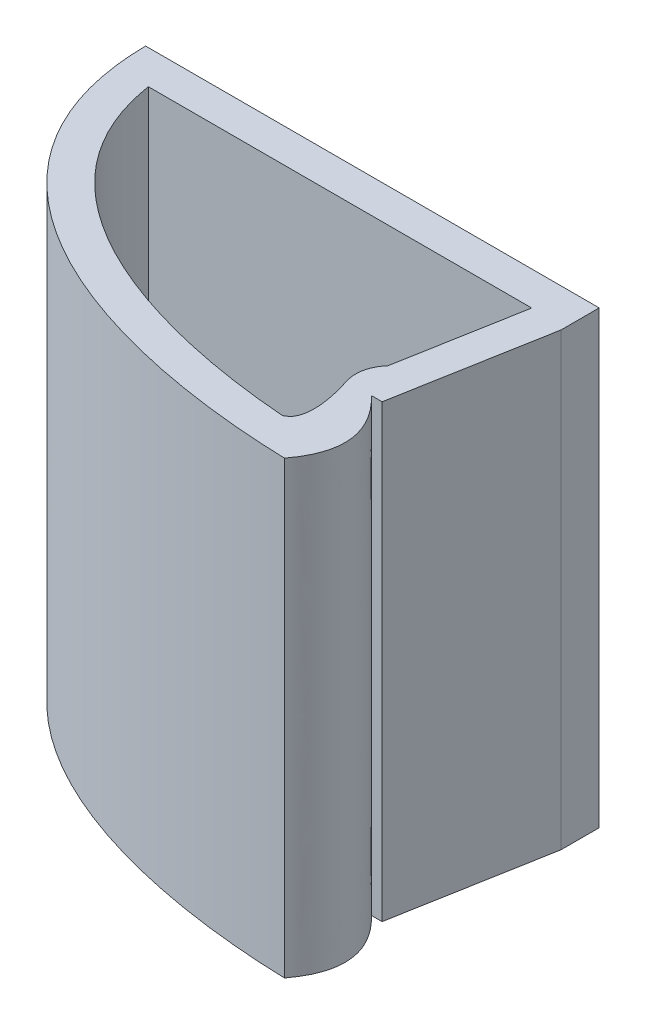
from build123d import *

# Parameters (mm, degrees)
SKETCH1_W           = 13.4
SKETCH1_H           = 13.3
BOSS_EXTRUDE1_DEPTH = 8.5
CUT_EXTRUDE1_DEPTH  = 21.705071842
CUT_EXTRUDE3_DEPTH  = 21.705072012
CUT_EXTRUDE4_DEPTH  = 21.701642146
FILLET1_R           = 1


with BuildPart() as part:
    # Sketch1 → Boss-Extrude1 (new body)
    with BuildSketch(Plane.XY):
        with Locations((6.7, 6.65)):
            Rectangle(SKETCH1_W, SKETCH1_H)
    extrude(amount=BOSS_EXTRUDE1_DEPTH)

    # Sketch2 → Cut-Extrude1 (cut, through all)
    with BuildSketch(Plane.XZ):
        with BuildLine():
            Line((0, 8.5), (0, 0))
            add(Edge.make_bspline(
                [(0, 0), (0.073718654, 6.709903839), (7.883498374, 8.466123585), (13.091968121, 8.5)],
                knots=[0, 0, 0, 0, 0.980472066, 0.980472066, 0.980472066, 0.980472066], degree=3))
            Line((13.091968121, 8.5), (0, 8.5))
        make_face()
    extrude(amount=-CUT_EXTRUDE1_DEPTH, mode=Mode.SUBTRACT)

    # Sketch3 → Cut-Extrude3 (cut, through all)
    with BuildSketch(Plane.XZ):
        with BuildLine():
            Line((13.4, 8.5), (13.091968233, 8.5))
            add(Edge.make_bspline(
                [(13.091968233, 8.500000001), (12.928751092, 8.498938421), (12.762979466, 8.4961855), (12.594971465, 8.491641803)],
                knots=[0, 0, 0, 0, 0.030724926, 0.030724926, 0.030724926, 0.030724926], degree=3))
            add(Edge.make_bspline(
                [(12.594971465, 8.491641803), (13.729005702, 6.994828786), (12.27798969, 5.607801465)],
                knots=[0, 0, 0, 1, 1, 1], degree=2))
            Line((12.27798969, 5.607801465), (12.594971465, 5.607801465))
            Line((12.594971465, 5.607801465), (13.4, 1.126740045))
            Line((13.4, 1.126740045), (13.4, 8.5))
        make_face()
    extrude(amount=-CUT_EXTRUDE3_DEPTH, mode=Mode.SUBTRACT)

    # Sketch4 → Cut-Extrude4 (cut, through all)
    with BuildSketch(Plane.XZ):
        with BuildLine():
            add(Edge.make_bspline(
                [(11.162050454, 4.607801465), (11.213167508, 4.724451541), (11.314763824, 4.965389249), (11.483094832, 5.403338852), (11.643196268, 5.901128047), (11.751940563, 6.402221541), (11.783684476, 6.800842723), (11.752398283, 7.085240041), (11.683853846, 7.255919003), (11.613948948, 7.348822838), (11.519214994, 7.411341569), (11.47258496, 7.432985767)],
                knots=[0.498991895, 0.498991895, 0.498991895, 0.498991895, 0.49906673, 0.499141565, 0.499291234, 0.499440904, 0.499590574, 0.499740243, 0.499889913, 0.500039582, 0.500189252, 0.500189252, 0.500189252, 0.500189252], degree=3))
            add(Edge.make_bspline(
                [(11.47258496, 7.432985767), (10.893745911, 7.38920843), (9.751249116, 7.261972079), (7.393841399, 6.805923692), (5.169270178, 6.017857558), (3.35518405, 4.858338166), (2.262837237, 3.805038418), (1.60534323, 2.759077747), (1.24696522, 1.808375346), (1.124623135, 1.267320349), (1.082503612, 1)],
                knots=[0.071068841, 0.071068841, 0.071068841, 0.071068841, 0.173545681, 0.276022522, 0.480976203, 0.583453043, 0.685929884, 0.788406724, 0.839645145, 0.890883565, 0.890883565, 0.890883565, 0.890883565], degree=3))
            Line((1.082503612, 1), (12.4, 1))
            Line((12.4, 1), (12.4, 1.037627698))
            Line((12.4, 1.037627698), (11.758613621, 4.607801465))
            Line((11.758613621, 4.607801465), (11.162050454, 4.607801465))
        make_face()
    extrude(amount=-CUT_EXTRUDE4_DEPTH, mode=Mode.SUBTRACT)

    # Fillet1
    # the kernel refuses this fillet: 1 mm, written as the material it takes off along each edge
    with BuildSketch(Plane(origin=(11.162050454, -2.640459986, 4.607801465), x_dir=(1, 0, 0), z_dir=(0, 1, 0))) as fillet1_piece_1:
        with BuildLine():
            CenterArc((1.331493249, -0.678142887), FILLET1_R, 137.301308413, 60.598480339)
            Line((0.379897712, -0.985495996), (0.360865801, -0.991643059))
            ThreePointArc((0.360865801, -0.991643059), (0.183572865, -0.495225733), (-0.018318378, -0.008027269))
            Line((-0.018318378, -0.008027269), (0, 0.02))
            ThreePointArc((0, 0.02), (0.298281584, 0.02), (0.581864566, 0.013562858))
            Line((0.581864566, 0.013562858), (0.596563167, 0))
        make_face()
    extrude(amount=18.580919972, mode=Mode.SUBTRACT)


solid = part.part
